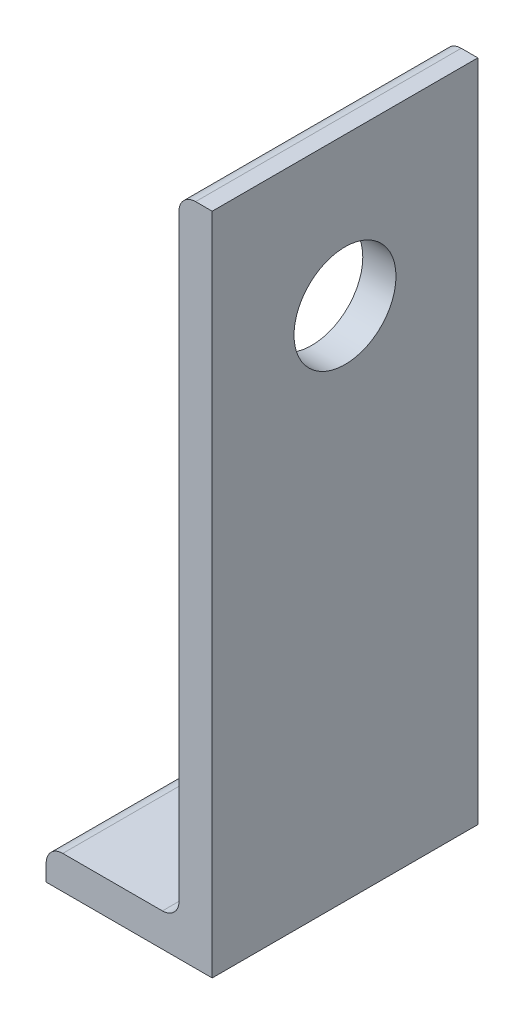
from build123d import *

# Parameters (mm, degrees)
BOSS_EXTRUDE1_DEPTH = 25.4
SKETCH3_R           = 4.765
CUT_EXTRUDE1_DEPTH  = 131.484388434
SKETCH4_R           = 9.75
CUT_EXTRUDE2_DEPTH  = 12.7


with BuildPart() as part:
    # Sketch2 → Boss-Extrude1 (new, symmetric)
    with BuildSketch(Plane.XY):
        with BuildLine():
            Line((-15.875, 0), (15.875, 0))
            Line((15.875, 0), (15.875, 127))
            Line((15.875, 127), (12.7, 127))
            ThreePointArc((12.7, 127), (10.45493597, 126.07006403), (9.525, 123.825))
            Line((9.525, 123.825), (9.525, 9.525))
            ThreePointArc((9.525, 9.525), (8.59506403, 7.27993597), (6.35, 6.35))
            Line((6.35, 6.35), (-12.7, 6.35))
            ThreePointArc((-12.7, 6.35), (-14.94506403, 5.42006403), (-15.875, 3.175))
            Line((-15.875, 3.175), (-15.875, 0))
        make_face()
    extrude(amount=BOSS_EXTRUDE1_DEPTH, both=True)

    # Sketch3 → Cut-Extrude1 (cut, through all)
    with BuildSketch(Plane.XZ):
        with Locations((-4.826, 0)):
            Circle(SKETCH3_R)
    extrude(amount=-CUT_EXTRUDE1_DEPTH, mode=Mode.SUBTRACT)

    # Sketch4 → Cut-Extrude2 (cut)
    with BuildSketch(Plane(origin=(15.875, 0, 0), x_dir=(0, 0, -1), z_dir=(1, 0, 0))):
        with Locations((0, 98.65)):
            Circle(SKETCH4_R)
    extrude(amount=-CUT_EXTRUDE2_DEPTH, mode=Mode.SUBTRACT)


solid = part.part
